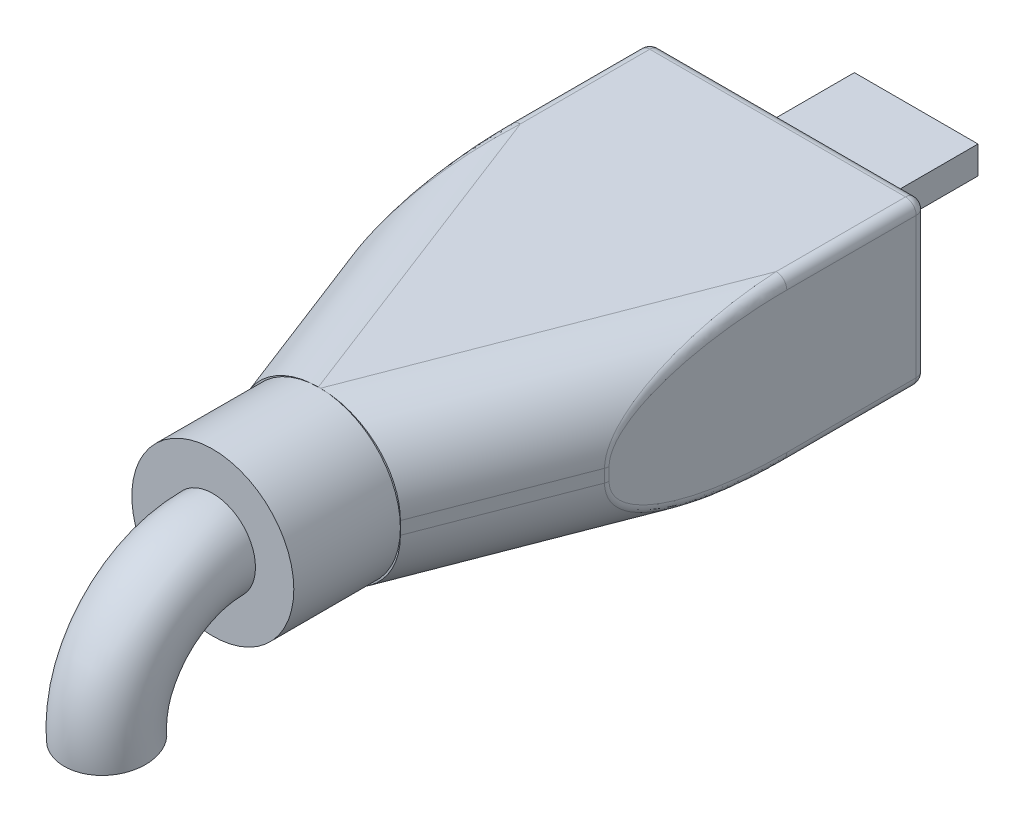
from build123d import *

# Parameters (mm, degrees)
SKETCH1_W           = 13
SKETCH1_H           = 7.6
BOSS_EXTRUDE1_DEPTH = 22
SKETCH2_W           = 5.8
SKETCH2_H           = 2.3
BOSS_EXTRUDE2_DEPTH = 6
CHAMFER1_SIZE       = 1
SKETCH3_R           = 3.8
BOSS_EXTRUDE3_DEPTH = 5
SWEEP1_PROFILE_R    = 2
CHAMFER2_SIZE       = 7
CHAMFER2_SIZE_2     = 2.7
FILLET1_R           = 3.5
FILLET2_R           = 0.5


with BuildPart() as part:
    # Sketch1 → Boss-Extrude1 (new body)
    with BuildSketch(Plane.XY):
        Rectangle(SKETCH1_W, SKETCH1_H)
    extrude(amount=BOSS_EXTRUDE1_DEPTH)

    # Sketch2 → Boss-Extrude2 (add)
    with BuildSketch(Plane.XY):
        Rectangle(SKETCH2_W, SKETCH2_H)
    extrude(amount=-BOSS_EXTRUDE2_DEPTH)

    # Chamfer1
    chamfer1_edges = [part.edges().sort_by_distance(p)[0] for p in [
        (2.9, -1.15, -3),
        (-2.9, -1.15, -3),
    ]]
    chamfer(chamfer1_edges, length=CHAMFER1_SIZE)

    # Sketch3 → Boss-Extrude3 (add)
    with BuildSketch(Plane.XY.offset(22)):
        with Locations(Location((0, 0, 0), (0, 0, 270))):
            Circle(SKETCH3_R)
    extrude(amount=BOSS_EXTRUDE3_DEPTH)

    # Sweep1: sweep along a path in Sketch4
    with BuildLine(Plane(origin=(0, 0, 0), x_dir=(0, 0, -1), z_dir=(1, 0, 0))) as sweep1_path:
        ThreePointArc((-27, 0), (-30.68473894, -1.620251645), (-31.981396149, -5.430920422))
    # Sweep1 profile (on start of the path) → Sweep1 (sweep)
    with BuildSketch(Plane.XY.offset(27)):
        Circle(SWEEP1_PROFILE_R)
    sweep(path=sweep1_path.line)

    # Chamfer2
    # the kernel refuses this chamfer: 7, 2.7 mm, written as the material it takes off along each edge
    with BuildSketch(Plane(origin=(-6.5, 21.954848956, 22), x_dir=(-0.013875656490629981, 0, -0.9999037284443708), z_dir=(0, -1, 0))) as chamfer2_piece_1_section:
        Polygon((CHAMFER2_SIZE * 0.999903728444, CHAMFER2_SIZE * 0.0138756564906), (-CHAMFER2_SIZE_2 * 0.0138756564906, CHAMFER2_SIZE_2 * 0.999903728444), (0, 0), align=None)
    chamfer2_piece_1 = extrude(amount=43.909697913, mode=Mode.PRIVATE)
    chamfer2_piece_1 = chamfer2_piece_1 - Plane(origin=(0, 0, 19.611585976), x_dir=(0, -1, 0), z_dir=(0, 0, -1)) * Cylinder(3.8, 116, mode=Mode.PRIVATE)
    add(chamfer2_piece_1, mode=Mode.SUBTRACT)
    with BuildSketch(Plane(origin=(6.5, -21.954848956, 22), x_dir=(0.013875656490629981, 0, -0.9999037284443708), z_dir=(0, 1, 0))) as chamfer2_piece_2_section:
        Polygon((CHAMFER2_SIZE * 0.999903728444, CHAMFER2_SIZE * 0.0138756564906), (-CHAMFER2_SIZE_2 * 0.0138756564906, CHAMFER2_SIZE_2 * 0.999903728444), (0, 0), align=None)
    chamfer2_piece_2 = extrude(amount=43.909697913, mode=Mode.PRIVATE)
    chamfer2_piece_2 = chamfer2_piece_2 - Plane(origin=(0, 0, 19.611585976), x_dir=(0, -1, 0), z_dir=(0, 0, -1)) * Cylinder(3.8, 116, mode=Mode.PRIVATE)
    add(chamfer2_piece_2, mode=Mode.SUBTRACT)

    # Fillet1
    fillet1_edges = [part.edges().sort_by_distance(p)[0] for p in [
        (5.15, -3.8, 18.5),
        (-5.15, -3.8, 18.5),
        (5.15, 3.8, 18.5),
        (-5.15, 3.8, 18.5),
    ]]
    fillet(fillet1_edges, radius=FILLET1_R)

    # Fillet2
    fillet2_edges = [part.edges().sort_by_distance(p)[0] for p in [
        (0, -3.8, 0),
        (-6.5, 0, 0),
        (0, 3.8, 0),
        (6.5, 0, 0),
        (-6.5, -3.8, 2.637160801),
        (6.5, -3.8, 2.637160801),
        (-6.5, 0, 15),
        (-6.5, 3.8, 2.637160801),
        (-6.5, 3.201194677, 10.714651102),
        (-6.5, -3.201194677, 10.714651102),
        (6.5, 0, 15),
        (6.5, 3.8, 2.637160801),
        (6.5, 3.201194677, 10.714651102),
        (6.5, -3.201194677, 10.714651102),
    ]]
    fillet(fillet2_edges, radius=FILLET2_R)


solid = part.part
